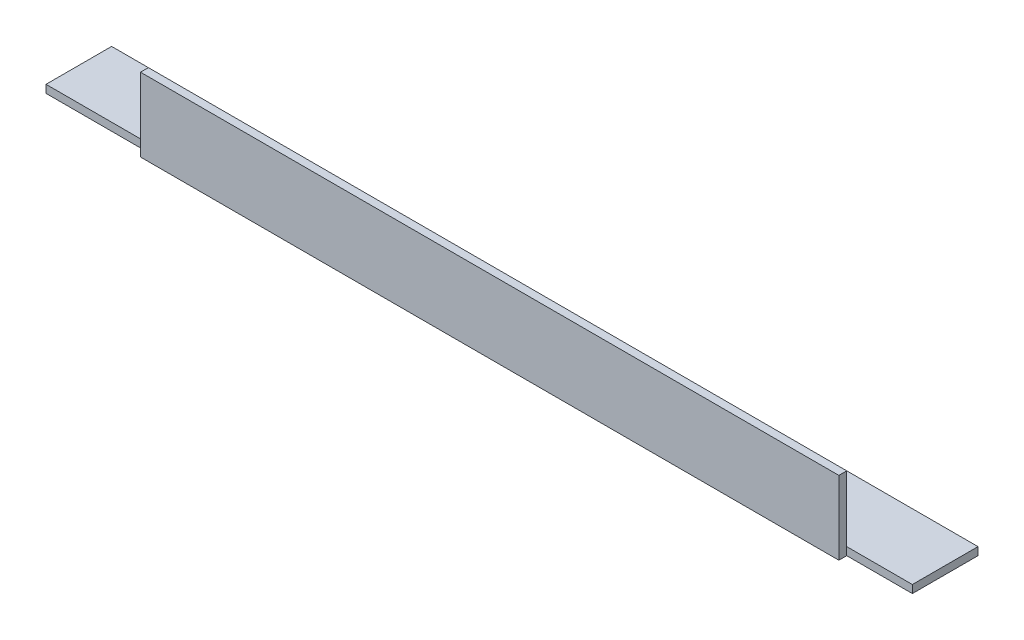
from build123d import *

# Parameters (mm, degrees)
EXTRUDE_1_DEPTH     = 330
SKETCH_2_W          = 39
SKETCH_2_H          = 3
SKETCH_2_W_2        = 25
CUT_EXTRUDE_1_DEPTH = 333.127987378


with BuildPart() as part:
    # Эскиз1 → Вытянуть-Тонкостенный1 (new body)
    with BuildSketch(Plane(origin=(0, 0, 0), x_dir=(0, 0, -1), z_dir=(1, 0, 0))):
        Polygon((0, 25), (0, 0), (25, 0), (25, -3), (-3, -3), (-3, 25), align=None)
    extrude(amount=EXTRUDE_1_DEPTH)

    # Эскиз2 → Вырез-Вытянуть1 (cut, through all)
    with BuildSketch(Plane.XZ.offset(3)):
        with Locations((19.5, 1.5)):
            Rectangle(SKETCH_2_W, SKETCH_2_H)
        with Locations((317.5, 1.5)):
            Rectangle(SKETCH_2_W_2, SKETCH_2_H)
    extrude(amount=-CUT_EXTRUDE_1_DEPTH, mode=Mode.SUBTRACT)


solid = part.part
